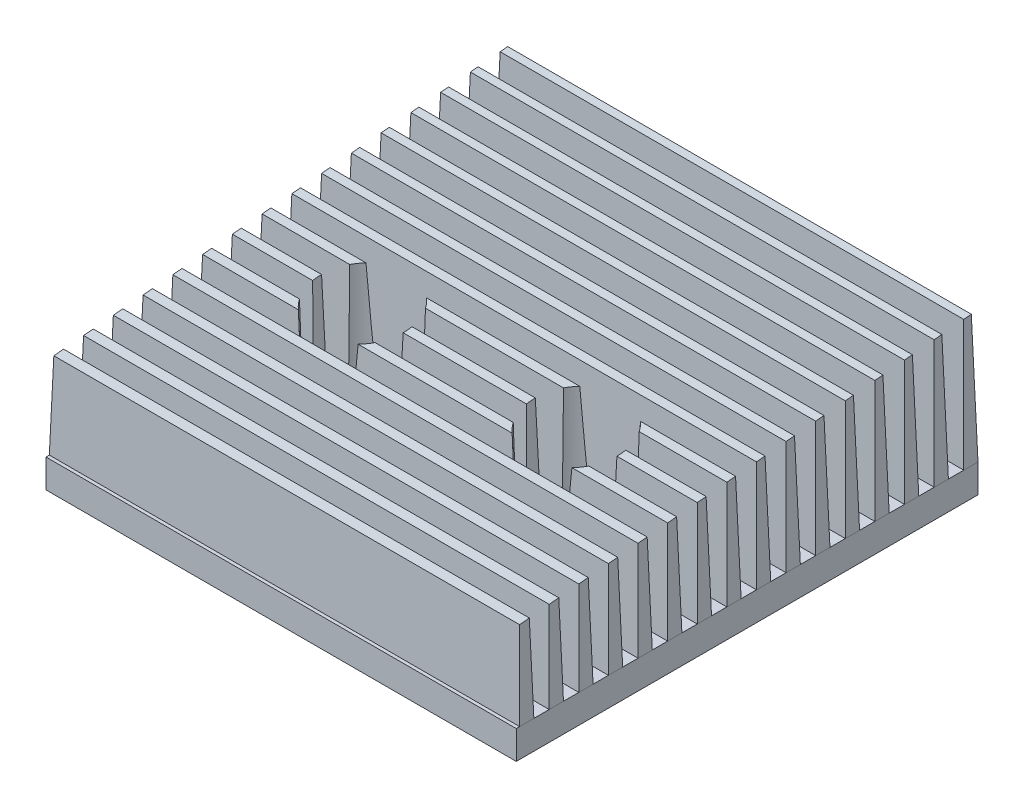
from build123d import *

# Parameters (mm, degrees)
SKETCH1_W                  = 41.91
SKETCH1_H                  = 48.768
SKETCH1_R                  = 1.5
BOSS_EXTRUDE1_DEPTH        = 2.54
BOSS_EXTRUDE2_DEPTH        = 11.43
BOSS_EXTRUDE2_DRAFT        = 1.5
BOSS_EXTRUDE2_2_DEPTH      = 11.43
BOSS_EXTRUDE2_2_DRAFT      = 1.5
BOSS_EXTRUDE2_3_DEPTH      = 11.43
BOSS_EXTRUDE2_3_DRAFT      = 1.5
BOSS_EXTRUDE2_4_DEPTH      = 11.43
BOSS_EXTRUDE2_4_DRAFT      = 1.5
BOSS_EXTRUDE2_5_DEPTH      = 11.43
BOSS_EXTRUDE2_5_DRAFT      = 1.5
BOSS_EXTRUDE2_6_DEPTH      = 11.43
BOSS_EXTRUDE2_6_DRAFT      = 1.5
BOSS_EXTRUDE2_7_DEPTH      = 11.43
BOSS_EXTRUDE2_7_DRAFT      = 1.5
BOSS_EXTRUDE2_8_DEPTH      = 11.43
BOSS_EXTRUDE2_8_DRAFT      = 1.5
BOSS_EXTRUDE2_9_DEPTH      = 11.43
BOSS_EXTRUDE2_9_DRAFT      = 1.5
BOSS_EXTRUDE2_10_OUTLINE_W = 41.311389832
BOSS_EXTRUDE2_10_OUTLINE_H = 0.671389833
BOSS_EXTRUDE2_10_DEPTH     = 11.43
BOSS_EXTRUDE2_10_DRAFT     = 1.5
BOSS_EXTRUDE2_11_OUTLINE_W = 41.311389832
BOSS_EXTRUDE2_11_OUTLINE_H = 0.671389833
BOSS_EXTRUDE2_11_DEPTH     = 11.43
BOSS_EXTRUDE2_11_DRAFT     = 1.5
BOSS_EXTRUDE2_12_OUTLINE_W = 41.311389832
BOSS_EXTRUDE2_12_OUTLINE_H = 0.671389833
BOSS_EXTRUDE2_12_DEPTH     = 11.43
BOSS_EXTRUDE2_12_DRAFT     = 1.5
BOSS_EXTRUDE2_13_OUTLINE_W = 41.311389832
BOSS_EXTRUDE2_13_OUTLINE_H = 0.671389833
BOSS_EXTRUDE2_13_DEPTH     = 11.43
BOSS_EXTRUDE2_13_DRAFT     = 1.5
BOSS_EXTRUDE2_14_OUTLINE_W = 41.311389832
BOSS_EXTRUDE2_14_OUTLINE_H = 0.671389833
BOSS_EXTRUDE2_14_DEPTH     = 11.43
BOSS_EXTRUDE2_14_DRAFT     = 1.5
BOSS_EXTRUDE2_15_OUTLINE_W = 41.311389832
BOSS_EXTRUDE2_15_OUTLINE_H = 0.671389833
BOSS_EXTRUDE2_15_DEPTH     = 11.43
BOSS_EXTRUDE2_15_DRAFT     = 1.5
BOSS_EXTRUDE2_16_OUTLINE_W = 41.311389832
BOSS_EXTRUDE2_16_OUTLINE_H = 0.671389833
BOSS_EXTRUDE2_16_DEPTH     = 11.43
BOSS_EXTRUDE2_16_DRAFT     = 1.5
BOSS_EXTRUDE2_17_OUTLINE_W = 41.311389832
BOSS_EXTRUDE2_17_OUTLINE_H = 0.671389833
BOSS_EXTRUDE2_17_DEPTH     = 11.43
BOSS_EXTRUDE2_17_DRAFT     = 1.5
BOSS_EXTRUDE2_18_OUTLINE_W = 41.311389832
BOSS_EXTRUDE2_18_OUTLINE_H = 0.671389833
BOSS_EXTRUDE2_18_DEPTH     = 11.43
BOSS_EXTRUDE2_18_DRAFT     = 1.5
BOSS_EXTRUDE2_19_OUTLINE_W = 41.311389832
BOSS_EXTRUDE2_19_OUTLINE_H = 0.671389833
BOSS_EXTRUDE2_19_DEPTH     = 11.43
BOSS_EXTRUDE2_19_DRAFT     = 1.5
BOSS_EXTRUDE2_20_OUTLINE_W = 41.311389832
BOSS_EXTRUDE2_20_OUTLINE_H = 0.671389833
BOSS_EXTRUDE2_20_DEPTH     = 11.43
BOSS_EXTRUDE2_20_DRAFT     = 1.5
BOSS_EXTRUDE2_21_OUTLINE_W = 41.311389832
BOSS_EXTRUDE2_21_OUTLINE_H = 0.671389833
BOSS_EXTRUDE2_21_DEPTH     = 11.43
BOSS_EXTRUDE2_21_DRAFT     = 1.5
BOSS_EXTRUDE2_22_OUTLINE_W = 41.311389832
BOSS_EXTRUDE2_22_OUTLINE_H = 0.671389833
BOSS_EXTRUDE2_22_DEPTH     = 11.43
BOSS_EXTRUDE2_22_DRAFT     = 1.5
BOSS_EXTRUDE2_23_OUTLINE_W = 41.311389832
BOSS_EXTRUDE2_23_OUTLINE_H = 0.671389833
BOSS_EXTRUDE2_23_DEPTH     = 11.43
BOSS_EXTRUDE2_23_DRAFT     = 1.5
BOSS_EXTRUDE2_24_OUTLINE_W = 41.311389832
BOSS_EXTRUDE2_24_OUTLINE_H = 0.671389832
BOSS_EXTRUDE2_24_DEPTH     = 11.43
BOSS_EXTRUDE2_24_DRAFT     = 1.5
BOSS_EXTRUDE2_25_OUTLINE_W = 41.311389832
BOSS_EXTRUDE2_25_OUTLINE_H = 0.671389832
BOSS_EXTRUDE2_25_DEPTH     = 11.43
BOSS_EXTRUDE2_25_DRAFT     = 1.5
CUT_EXTRUDE1_DEPTH         = 35.122373613
CUT_EXTRUDE1_DEPTH_BACK    = 35.122373613
SKETCH3_W                  = 41.91
SKETCH3_H                  = 7.62
CUT_EXTRUDE2_DEPTH         = 51.459770669
CUT_EXTRUDE2_DEPTH_BACK    = 51.459770669
SKETCH4_OUTSIDE_W          = 55.222
SKETCH4_OUTSIDE_H          = 28.044


# Read off the part's stored shape, not the designer's step: Boss-Extrude2
with BuildPart() as part:
    # Sketch1 → Boss-Extrude1 (new body)
    with BuildSketch(Plane(origin=(0, 0, 0), x_dir=(1, 0, 0), z_dir=(0, 1, 0))):
        Rectangle(SKETCH1_W, SKETCH1_H)
        with Locations(Location((-9.525, 0, 0), (0, 0, 270))):
            Circle(SKETCH1_R, mode=Mode.SUBTRACT)
        with Locations(Location((9.525, 0, 0), (0, 0, 270))):
            Circle(SKETCH1_R, mode=Mode.SUBTRACT)
    extrude(amount=BOSS_EXTRUDE1_DEPTH)


with BuildPart() as boss_extrude2_tool:
    # Boss-Extrude2 outline → Boss-Extrude2 (with draft: the straight prism first)
    with BuildSketch(Plane(origin=(0, 13.97, 0), x_dir=(1, 0, 0), z_dir=(0, 1, 0))):
        with BuildLine():
            ThreePointArc((6.68970452, -2.974472694), (6.387709227, -2.65401486), (6.121737212, -2.303082861))
            Line((6.121737212, -2.303082861), (-6.121737212, -2.303082861))
            ThreePointArc((-6.121737212, -2.303082861), (-6.387709227, -2.65401486), (-6.68970452, -2.974472694))
            Line((-6.68970452, -2.974472694), (6.68970452, -2.974472694))
        make_face()
    extrude(amount=-BOSS_EXTRUDE2_DEPTH)
    # Boss-Extrude2: the draft: its side faces are tilted about the plane it starts from
    boss_extrude2_sides = [boss_extrude2_tool.faces().sort_by_distance(p)[0] for p in [
        (6.387709227, 8.255, 2.65401486),
        (0, 8.255, 2.303082861),
        (-6.387709227, 8.255, 2.65401486),
        (0, 8.255, 2.974472694),
    ]]
    draft(boss_extrude2_sides, Plane(origin=(0, 13.97, 0), x_dir=(1, 0, 0), z_dir=(0, 1, 0)), BOSS_EXTRUDE2_DRAFT)


with BuildPart() as part_1:
    add(part.part)

    # Boss-Extrude2: add boss_extrude2_tool
    add(boss_extrude2_tool.part)


with BuildPart() as boss_extrude2_2_tool:
    # Boss-Extrude2 2 outline → Boss-Extrude2 2 (with draft: the straight prism first)
    with BuildSketch(Plane(origin=(0, 13.97, 0), x_dir=(1, 0, 0), z_dir=(0, 1, 0))):
        with BuildLine():
            ThreePointArc((5.429429564, -0.335694916), (5.415694916, 0), (5.429429564, 0.335694916))
            Line((5.429429564, 0.335694916), (-5.429429564, 0.335694916))
            ThreePointArc((-5.429429564, 0.335694916), (-5.415694916, 0), (-5.429429564, -0.335694916))
            Line((-5.429429564, -0.335694916), (5.429429564, -0.335694916))
        make_face()
    extrude(amount=-BOSS_EXTRUDE2_2_DEPTH)
    # Boss-Extrude2 2: the draft: its side faces are tilted about the plane it starts from
    boss_extrude2_2_sides = [boss_extrude2_2_tool.faces().sort_by_distance(p)[0] for p in [
        (0, 8.255, 0.335694916),
        (5.415694916, 8.255, 0),
        (0, 8.255, -0.335694916),
        (-5.415694916, 8.255, 0),
    ]]
    draft(boss_extrude2_2_sides, Plane(origin=(0, 13.97, 0), x_dir=(1, 0, 0), z_dir=(0, 1, 0)), BOSS_EXTRUDE2_2_DRAFT)


with BuildPart() as part_2:
    add(part_1.part)

    # Boss-Extrude2 2: add boss_extrude2_2_tool
    add(boss_extrude2_2_tool.part)


with BuildPart() as boss_extrude2_3_tool:
    # Boss-Extrude2 3 outline → Boss-Extrude2 3 (with draft: the straight prism first)
    with BuildSketch(Plane(origin=(0, 13.97, 0), x_dir=(1, 0, 0), z_dir=(0, 1, 0))):
        with BuildLine():
            ThreePointArc((6.121737212, 2.303082861), (6.387709227, 2.65401486), (6.68970452, 2.974472694))
            Line((6.68970452, 2.974472694), (-6.68970452, 2.974472694))
            ThreePointArc((-6.68970452, 2.974472694), (-6.387709227, 2.65401486), (-6.121737212, 2.303082861))
            Line((-6.121737212, 2.303082861), (6.121737212, 2.303082861))
        make_face()
    extrude(amount=-BOSS_EXTRUDE2_3_DEPTH)
    # Boss-Extrude2 3: the draft: its side faces are tilted about the plane it starts from
    boss_extrude2_3_sides = [boss_extrude2_3_tool.faces().sort_by_distance(p)[0] for p in [
        (-6.387709227, 8.255, -2.65401486),
        (0, 8.255, -2.303082861),
        (6.387709227, 8.255, -2.65401486),
        (0, 8.255, -2.974472694),
    ]]
    draft(boss_extrude2_3_sides, Plane(origin=(0, 13.97, 0), x_dir=(1, 0, 0), z_dir=(0, 1, 0)), BOSS_EXTRUDE2_3_DRAFT)


with BuildPart() as part_3:
    add(part_2.part)

    # Boss-Extrude2 3: add boss_extrude2_3_tool
    add(boss_extrude2_3_tool.part)


with BuildPart() as boss_extrude2_4_tool:
    # Boss-Extrude2 4 outline → Boss-Extrude2 4 (with draft: the straight prism first)
    with BuildSketch(Plane(origin=(0, 13.97, 0), x_dir=(1, 0, 0), z_dir=(0, 1, 0))):
        with BuildLine():
            ThreePointArc((12.928262788, -2.303082861), (12.662290773, -2.65401486), (12.36029548, -2.974472694))
            Line((12.36029548, -2.974472694), (20.655694916, -2.974472694))
            Line((20.655694916, -2.974472694), (20.655694916, -2.303082861))
            Line((20.655694916, -2.303082861), (12.928262788, -2.303082861))
        make_face()
    extrude(amount=-BOSS_EXTRUDE2_4_DEPTH)
    # Boss-Extrude2 4: the draft: its side faces are tilted about the plane it starts from
    boss_extrude2_4_sides = [boss_extrude2_4_tool.faces().sort_by_distance(p)[0] for p in [
        (12.662290773, 8.255, 2.65401486),
        (16.507995198, 8.255, 2.974472694),
        (20.655694916, 8.255, 2.638777778),
        (16.791978852, 8.255, 2.303082861),
    ]]
    draft(boss_extrude2_4_sides, Plane(origin=(0, 13.97, 0), x_dir=(1, 0, 0), z_dir=(0, 1, 0)), BOSS_EXTRUDE2_4_DRAFT)


with BuildPart() as part_4:
    add(part_3.part)

    # Boss-Extrude2 4: add boss_extrude2_4_tool
    add(boss_extrude2_4_tool.part)


with BuildPart() as boss_extrude2_5_tool:
    # Boss-Extrude2 5 outline → Boss-Extrude2 5 (with draft: the straight prism first)
    with BuildSketch(Plane(origin=(0, 13.97, 0), x_dir=(1, 0, 0), z_dir=(0, 1, 0))):
        with BuildLine():
            ThreePointArc((13.620570436, 0.335694916), (13.634305084, 0), (13.620570436, -0.335694916))
            Line((13.620570436, -0.335694916), (20.655694916, -0.335694916))
            Line((20.655694916, -0.335694916), (20.655694916, 0.335694916))
            Line((20.655694916, 0.335694916), (13.620570436, 0.335694916))
        make_face()
    extrude(amount=-BOSS_EXTRUDE2_5_DEPTH)
    # Boss-Extrude2 5: the draft: its side faces are tilted about the plane it starts from
    boss_extrude2_5_sides = [boss_extrude2_5_tool.faces().sort_by_distance(p)[0] for p in [
        (13.634305084, 8.255, 0),
        (17.138132676, 8.255, 0.335694916),
        (20.655694916, 8.255, 0),
        (17.138132676, 8.255, -0.335694916),
    ]]
    draft(boss_extrude2_5_sides, Plane(origin=(0, 13.97, 0), x_dir=(1, 0, 0), z_dir=(0, 1, 0)), BOSS_EXTRUDE2_5_DRAFT)


with BuildPart() as part_5:
    add(part_4.part)

    # Boss-Extrude2 5: add boss_extrude2_5_tool
    add(boss_extrude2_5_tool.part)


with BuildPart() as boss_extrude2_6_tool:
    # Boss-Extrude2 6 outline → Boss-Extrude2 6 (with draft: the straight prism first)
    with BuildSketch(Plane(origin=(0, 13.97, 0), x_dir=(1, 0, 0), z_dir=(0, 1, 0))):
        with BuildLine():
            ThreePointArc((12.36029548, 2.974472694), (12.662290773, 2.65401486), (12.928262788, 2.303082861))
            Line((12.928262788, 2.303082861), (20.655694916, 2.303082861))
            Line((20.655694916, 2.303082861), (20.655694916, 2.974472694))
            Line((20.655694916, 2.974472694), (12.36029548, 2.974472694))
        make_face()
    extrude(amount=-BOSS_EXTRUDE2_6_DEPTH)
    # Boss-Extrude2 6: the draft: its side faces are tilted about the plane it starts from
    boss_extrude2_6_sides = [boss_extrude2_6_tool.faces().sort_by_distance(p)[0] for p in [
        (12.662290773, 8.255, -2.65401486),
        (16.791978852, 8.255, -2.303082861),
        (20.655694916, 8.255, -2.638777778),
        (16.507995198, 8.255, -2.974472694),
    ]]
    draft(boss_extrude2_6_sides, Plane(origin=(0, 13.97, 0), x_dir=(1, 0, 0), z_dir=(0, 1, 0)), BOSS_EXTRUDE2_6_DRAFT)


with BuildPart() as part_6:
    add(part_5.part)

    # Boss-Extrude2 6: add boss_extrude2_6_tool
    add(boss_extrude2_6_tool.part)


with BuildPart() as boss_extrude2_7_tool:
    # Boss-Extrude2 7 outline → Boss-Extrude2 7 (with draft: the straight prism first)
    with BuildSketch(Plane(origin=(0, 13.97, 0), x_dir=(1, 0, 0), z_dir=(0, 1, 0))):
        with BuildLine():
            ThreePointArc((-12.36029548, -2.974472694), (-12.662290773, -2.65401486), (-12.928262788, -2.303082861))
            Line((-12.928262788, -2.303082861), (-20.655694916, -2.303082861))
            Line((-20.655694916, -2.303082861), (-20.655694916, -2.974472694))
            Line((-20.655694916, -2.974472694), (-12.36029548, -2.974472694))
        make_face()
    extrude(amount=-BOSS_EXTRUDE2_7_DEPTH)
    # Boss-Extrude2 7: the draft: its side faces are tilted about the plane it starts from
    boss_extrude2_7_sides = [boss_extrude2_7_tool.faces().sort_by_distance(p)[0] for p in [
        (-12.662290773, 8.255, 2.65401486),
        (-16.791978852, 8.255, 2.303082861),
        (-20.655694916, 8.255, 2.638777778),
        (-16.507995198, 8.255, 2.974472694),
    ]]
    draft(boss_extrude2_7_sides, Plane(origin=(0, 13.97, 0), x_dir=(1, 0, 0), z_dir=(0, 1, 0)), BOSS_EXTRUDE2_7_DRAFT)


with BuildPart() as part_7:
    add(part_6.part)

    # Boss-Extrude2 7: add boss_extrude2_7_tool
    add(boss_extrude2_7_tool.part)


with BuildPart() as boss_extrude2_8_tool:
    # Boss-Extrude2 8 outline → Boss-Extrude2 8 (with draft: the straight prism first)
    with BuildSketch(Plane(origin=(0, 13.97, 0), x_dir=(1, 0, 0), z_dir=(0, 1, 0))):
        with BuildLine():
            ThreePointArc((-13.620570436, -0.335694916), (-13.634305084, 0), (-13.620570436, 0.335694916))
            Line((-13.620570436, 0.335694916), (-20.655694916, 0.335694916))
            Line((-20.655694916, 0.335694916), (-20.655694916, -0.335694916))
            Line((-20.655694916, -0.335694916), (-13.620570436, -0.335694916))
        make_face()
    extrude(amount=-BOSS_EXTRUDE2_8_DEPTH)
    # Boss-Extrude2 8: the draft: its side faces are tilted about the plane it starts from
    boss_extrude2_8_sides = [boss_extrude2_8_tool.faces().sort_by_distance(p)[0] for p in [
        (-13.634305084, 8.255, 0),
        (-17.138132676, 8.255, -0.335694916),
        (-20.655694916, 8.255, 0),
        (-17.138132676, 8.255, 0.335694916),
    ]]
    draft(boss_extrude2_8_sides, Plane(origin=(0, 13.97, 0), x_dir=(1, 0, 0), z_dir=(0, 1, 0)), BOSS_EXTRUDE2_8_DRAFT)


with BuildPart() as part_8:
    add(part_7.part)

    # Boss-Extrude2 8: add boss_extrude2_8_tool
    add(boss_extrude2_8_tool.part)


with BuildPart() as boss_extrude2_9_tool:
    # Boss-Extrude2 9 outline → Boss-Extrude2 9 (with draft: the straight prism first)
    with BuildSketch(Plane(origin=(0, 13.97, 0), x_dir=(1, 0, 0), z_dir=(0, 1, 0))):
        with BuildLine():
            ThreePointArc((-12.928262788, 2.303082861), (-12.662290773, 2.65401486), (-12.36029548, 2.974472694))
            Line((-12.36029548, 2.974472694), (-20.655694916, 2.974472694))
            Line((-20.655694916, 2.974472694), (-20.655694916, 2.303082861))
            Line((-20.655694916, 2.303082861), (-12.928262788, 2.303082861))
        make_face()
    extrude(amount=-BOSS_EXTRUDE2_9_DEPTH)
    # Boss-Extrude2 9: the draft: its side faces are tilted about the plane it starts from
    boss_extrude2_9_sides = [boss_extrude2_9_tool.faces().sort_by_distance(p)[0] for p in [
        (-12.662290773, 8.255, -2.65401486),
        (-16.507995198, 8.255, -2.974472694),
        (-20.655694916, 8.255, -2.638777778),
        (-16.791978852, 8.255, -2.303082861),
    ]]
    draft(boss_extrude2_9_sides, Plane(origin=(0, 13.97, 0), x_dir=(1, 0, 0), z_dir=(0, 1, 0)), BOSS_EXTRUDE2_9_DRAFT)


with BuildPart() as part_9:
    add(part_8.part)

    # Boss-Extrude2 9: add boss_extrude2_9_tool
    add(boss_extrude2_9_tool.part)


with BuildPart() as boss_extrude2_10_tool:
    # Boss-Extrude2 10 outline → Boss-Extrude2 10 (with draft: the straight prism first)
    with BuildSketch(Plane(origin=(0, 13.97, 0), x_dir=(1, 0, 0), z_dir=(0, 1, 0))):
        with Locations((0, -21.110222222)):
            Rectangle(BOSS_EXTRUDE2_10_OUTLINE_W, BOSS_EXTRUDE2_10_OUTLINE_H)
    extrude(amount=-BOSS_EXTRUDE2_10_DEPTH)
    # Boss-Extrude2 10: the draft: its side faces are tilted about the plane it starts from
    boss_extrude2_10_sides = [boss_extrude2_10_tool.faces().sort_by_distance(p)[0] for p in [
        (0, 8.255, 20.774527306),
        (-20.655694916, 8.255, 21.110222222),
        (0, 8.255, 21.445917139),
        (20.655694916, 8.255, 21.110222222),
    ]]
    draft(boss_extrude2_10_sides, Plane(origin=(0, 13.97, 0), x_dir=(1, 0, 0), z_dir=(0, 1, 0)), BOSS_EXTRUDE2_10_DRAFT)


with BuildPart() as part_10:
    add(part_9.part)

    # Boss-Extrude2 10: add boss_extrude2_10_tool
    add(boss_extrude2_10_tool.part)


with BuildPart() as boss_extrude2_11_tool:
    # Boss-Extrude2 11 outline → Boss-Extrude2 11 (with draft: the straight prism first)
    with BuildSketch(Plane(origin=(0, 13.97, 0), x_dir=(1, 0, 0), z_dir=(0, 1, 0))):
        with Locations((0, -18.471444445)):
            Rectangle(BOSS_EXTRUDE2_11_OUTLINE_W, BOSS_EXTRUDE2_11_OUTLINE_H)
    extrude(amount=-BOSS_EXTRUDE2_11_DEPTH)
    # Boss-Extrude2 11: the draft: its side faces are tilted about the plane it starts from
    boss_extrude2_11_sides = [boss_extrude2_11_tool.faces().sort_by_distance(p)[0] for p in [
        (0, 8.255, 18.135749528),
        (-20.655694916, 8.255, 18.471444445),
        (0, 8.255, 18.807139361),
        (20.655694916, 8.255, 18.471444445),
    ]]
    draft(boss_extrude2_11_sides, Plane(origin=(0, 13.97, 0), x_dir=(1, 0, 0), z_dir=(0, 1, 0)), BOSS_EXTRUDE2_11_DRAFT)


with BuildPart() as part_11:
    add(part_10.part)

    # Boss-Extrude2 11: add boss_extrude2_11_tool
    add(boss_extrude2_11_tool.part)


with BuildPart() as boss_extrude2_12_tool:
    # Boss-Extrude2 12 outline → Boss-Extrude2 12 (with draft: the straight prism first)
    with BuildSketch(Plane(origin=(0, 13.97, 0), x_dir=(1, 0, 0), z_dir=(0, 1, 0))):
        with Locations((0, -15.832666666)):
            Rectangle(BOSS_EXTRUDE2_12_OUTLINE_W, BOSS_EXTRUDE2_12_OUTLINE_H)
    extrude(amount=-BOSS_EXTRUDE2_12_DEPTH)
    # Boss-Extrude2 12: the draft: its side faces are tilted about the plane it starts from
    boss_extrude2_12_sides = [boss_extrude2_12_tool.faces().sort_by_distance(p)[0] for p in [
        (0, 8.255, 15.49697175),
        (-20.655694916, 8.255, 15.832666666),
        (0, 8.255, 16.168361583),
        (20.655694916, 8.255, 15.832666666),
    ]]
    draft(boss_extrude2_12_sides, Plane(origin=(0, 13.97, 0), x_dir=(1, 0, 0), z_dir=(0, 1, 0)), BOSS_EXTRUDE2_12_DRAFT)


with BuildPart() as part_12:
    add(part_11.part)

    # Boss-Extrude2 12: add boss_extrude2_12_tool
    add(boss_extrude2_12_tool.part)


with BuildPart() as boss_extrude2_13_tool:
    # Boss-Extrude2 13 outline → Boss-Extrude2 13 (with draft: the straight prism first)
    with BuildSketch(Plane(origin=(0, 13.97, 0), x_dir=(1, 0, 0), z_dir=(0, 1, 0))):
        with Locations((0, -13.193888889)):
            Rectangle(BOSS_EXTRUDE2_13_OUTLINE_W, BOSS_EXTRUDE2_13_OUTLINE_H)
    extrude(amount=-BOSS_EXTRUDE2_13_DEPTH)
    # Boss-Extrude2 13: the draft: its side faces are tilted about the plane it starts from
    boss_extrude2_13_sides = [boss_extrude2_13_tool.faces().sort_by_distance(p)[0] for p in [
        (0, 8.255, 12.858193972),
        (-20.655694916, 8.255, 13.193888889),
        (0, 8.255, 13.529583805),
        (20.655694916, 8.255, 13.193888889),
    ]]
    draft(boss_extrude2_13_sides, Plane(origin=(0, 13.97, 0), x_dir=(1, 0, 0), z_dir=(0, 1, 0)), BOSS_EXTRUDE2_13_DRAFT)


with BuildPart() as part_13:
    add(part_12.part)

    # Boss-Extrude2 13: add boss_extrude2_13_tool
    add(boss_extrude2_13_tool.part)


with BuildPart() as boss_extrude2_14_tool:
    # Boss-Extrude2 14 outline → Boss-Extrude2 14 (with draft: the straight prism first)
    with BuildSketch(Plane(origin=(0, 13.97, 0), x_dir=(1, 0, 0), z_dir=(0, 1, 0))):
        with Locations((0, -10.555111112)):
            Rectangle(BOSS_EXTRUDE2_14_OUTLINE_W, BOSS_EXTRUDE2_14_OUTLINE_H)
    extrude(amount=-BOSS_EXTRUDE2_14_DEPTH)
    # Boss-Extrude2 14: the draft: its side faces are tilted about the plane it starts from
    boss_extrude2_14_sides = [boss_extrude2_14_tool.faces().sort_by_distance(p)[0] for p in [
        (0, 8.255, 10.219416195),
        (-20.655694916, 8.255, 10.555111112),
        (0, 8.255, 10.890806028),
        (20.655694916, 8.255, 10.555111112),
    ]]
    draft(boss_extrude2_14_sides, Plane(origin=(0, 13.97, 0), x_dir=(1, 0, 0), z_dir=(0, 1, 0)), BOSS_EXTRUDE2_14_DRAFT)


with BuildPart() as part_14:
    add(part_13.part)

    # Boss-Extrude2 14: add boss_extrude2_14_tool
    add(boss_extrude2_14_tool.part)


with BuildPart() as boss_extrude2_15_tool:
    # Boss-Extrude2 15 outline → Boss-Extrude2 15 (with draft: the straight prism first)
    with BuildSketch(Plane(origin=(0, 13.97, 0), x_dir=(1, 0, 0), z_dir=(0, 1, 0))):
        with Locations((0, -5.277555556)):
            Rectangle(BOSS_EXTRUDE2_15_OUTLINE_W, BOSS_EXTRUDE2_15_OUTLINE_H)
    extrude(amount=-BOSS_EXTRUDE2_15_DEPTH)
    # Boss-Extrude2 15: the draft: its side faces are tilted about the plane it starts from
    boss_extrude2_15_sides = [boss_extrude2_15_tool.faces().sort_by_distance(p)[0] for p in [
        (0, 8.255, 4.941860639),
        (-20.655694916, 8.255, 5.277555556),
        (0, 8.255, 5.613250472),
        (20.655694916, 8.255, 5.277555555),
    ]]
    draft(boss_extrude2_15_sides, Plane(origin=(0, 13.97, 0), x_dir=(1, 0, 0), z_dir=(0, 1, 0)), BOSS_EXTRUDE2_15_DRAFT)


with BuildPart() as part_15:
    add(part_14.part)

    # Boss-Extrude2 15: add boss_extrude2_15_tool
    add(boss_extrude2_15_tool.part)


with BuildPart() as boss_extrude2_16_tool:
    # Boss-Extrude2 16 outline → Boss-Extrude2 16 (with draft: the straight prism first)
    with BuildSketch(Plane(origin=(0, 13.97, 0), x_dir=(1, 0, 0), z_dir=(0, 1, 0))):
        with Locations((0, 5.277555556)):
            Rectangle(BOSS_EXTRUDE2_16_OUTLINE_W, BOSS_EXTRUDE2_16_OUTLINE_H)
    extrude(amount=-BOSS_EXTRUDE2_16_DEPTH)
    # Boss-Extrude2 16: the draft: its side faces are tilted about the plane it starts from
    boss_extrude2_16_sides = [boss_extrude2_16_tool.faces().sort_by_distance(p)[0] for p in [
        (0, 8.255, -5.613250472),
        (-20.655694916, 8.255, -5.277555555),
        (0, 8.255, -4.941860639),
        (20.655694916, 8.255, -5.277555556),
    ]]
    draft(boss_extrude2_16_sides, Plane(origin=(0, 13.97, 0), x_dir=(1, 0, 0), z_dir=(0, 1, 0)), BOSS_EXTRUDE2_16_DRAFT)


with BuildPart() as part_16:
    add(part_15.part)

    # Boss-Extrude2 16: add boss_extrude2_16_tool
    add(boss_extrude2_16_tool.part)


with BuildPart() as boss_extrude2_17_tool:
    # Boss-Extrude2 17 outline → Boss-Extrude2 17 (with draft: the straight prism first)
    with BuildSketch(Plane(origin=(0, 13.97, 0), x_dir=(1, 0, 0), z_dir=(0, 1, 0))):
        with Locations((0, 7.916333334)):
            Rectangle(BOSS_EXTRUDE2_17_OUTLINE_W, BOSS_EXTRUDE2_17_OUTLINE_H)
    extrude(amount=-BOSS_EXTRUDE2_17_DEPTH)
    # Boss-Extrude2 17: the draft: its side faces are tilted about the plane it starts from
    boss_extrude2_17_sides = [boss_extrude2_17_tool.faces().sort_by_distance(p)[0] for p in [
        (0, 8.255, -8.25202825),
        (-20.655694916, 8.255, -7.916333333),
        (0, 8.255, -7.580638417),
        (20.655694916, 8.255, -7.916333333),
    ]]
    draft(boss_extrude2_17_sides, Plane(origin=(0, 13.97, 0), x_dir=(1, 0, 0), z_dir=(0, 1, 0)), BOSS_EXTRUDE2_17_DRAFT)


with BuildPart() as part_17:
    add(part_16.part)

    # Boss-Extrude2 17: add boss_extrude2_17_tool
    add(boss_extrude2_17_tool.part)


with BuildPart() as boss_extrude2_18_tool:
    # Boss-Extrude2 18 outline → Boss-Extrude2 18 (with draft: the straight prism first)
    with BuildSketch(Plane(origin=(0, 13.97, 0), x_dir=(1, 0, 0), z_dir=(0, 1, 0))):
        with Locations((0, 10.555111112)):
            Rectangle(BOSS_EXTRUDE2_18_OUTLINE_W, BOSS_EXTRUDE2_18_OUTLINE_H)
    extrude(amount=-BOSS_EXTRUDE2_18_DEPTH)
    # Boss-Extrude2 18: the draft: its side faces are tilted about the plane it starts from
    boss_extrude2_18_sides = [boss_extrude2_18_tool.faces().sort_by_distance(p)[0] for p in [
        (0, 8.255, -10.890806028),
        (-20.655694916, 8.255, -10.555111112),
        (0, 8.255, -10.219416195),
        (20.655694916, 8.255, -10.555111112),
    ]]
    draft(boss_extrude2_18_sides, Plane(origin=(0, 13.97, 0), x_dir=(1, 0, 0), z_dir=(0, 1, 0)), BOSS_EXTRUDE2_18_DRAFT)


with BuildPart() as part_18:
    add(part_17.part)

    # Boss-Extrude2 18: add boss_extrude2_18_tool
    add(boss_extrude2_18_tool.part)


with BuildPart() as boss_extrude2_19_tool:
    # Boss-Extrude2 19 outline → Boss-Extrude2 19 (with draft: the straight prism first)
    with BuildSketch(Plane(origin=(0, 13.97, 0), x_dir=(1, 0, 0), z_dir=(0, 1, 0))):
        with Locations((0, 13.193888889)):
            Rectangle(BOSS_EXTRUDE2_19_OUTLINE_W, BOSS_EXTRUDE2_19_OUTLINE_H)
    extrude(amount=-BOSS_EXTRUDE2_19_DEPTH)
    # Boss-Extrude2 19: the draft: its side faces are tilted about the plane it starts from
    boss_extrude2_19_sides = [boss_extrude2_19_tool.faces().sort_by_distance(p)[0] for p in [
        (0, 8.255, -13.529583805),
        (-20.655694916, 8.255, -13.193888889),
        (0, 8.255, -12.858193972),
        (20.655694916, 8.255, -13.193888889),
    ]]
    draft(boss_extrude2_19_sides, Plane(origin=(0, 13.97, 0), x_dir=(1, 0, 0), z_dir=(0, 1, 0)), BOSS_EXTRUDE2_19_DRAFT)


with BuildPart() as part_19:
    add(part_18.part)

    # Boss-Extrude2 19: add boss_extrude2_19_tool
    add(boss_extrude2_19_tool.part)


with BuildPart() as boss_extrude2_20_tool:
    # Boss-Extrude2 20 outline → Boss-Extrude2 20 (with draft: the straight prism first)
    with BuildSketch(Plane(origin=(0, 13.97, 0), x_dir=(1, 0, 0), z_dir=(0, 1, 0))):
        with Locations((0, 15.832666666)):
            Rectangle(BOSS_EXTRUDE2_20_OUTLINE_W, BOSS_EXTRUDE2_20_OUTLINE_H)
    extrude(amount=-BOSS_EXTRUDE2_20_DEPTH)
    # Boss-Extrude2 20: the draft: its side faces are tilted about the plane it starts from
    boss_extrude2_20_sides = [boss_extrude2_20_tool.faces().sort_by_distance(p)[0] for p in [
        (0, 8.255, -16.168361583),
        (-20.655694916, 8.255, -15.832666666),
        (0, 8.255, -15.49697175),
        (20.655694916, 8.255, -15.832666666),
    ]]
    draft(boss_extrude2_20_sides, Plane(origin=(0, 13.97, 0), x_dir=(1, 0, 0), z_dir=(0, 1, 0)), BOSS_EXTRUDE2_20_DRAFT)


with BuildPart() as part_20:
    add(part_19.part)

    # Boss-Extrude2 20: add boss_extrude2_20_tool
    add(boss_extrude2_20_tool.part)


with BuildPart() as boss_extrude2_21_tool:
    # Boss-Extrude2 21 outline → Boss-Extrude2 21 (with draft: the straight prism first)
    with BuildSketch(Plane(origin=(0, 13.97, 0), x_dir=(1, 0, 0), z_dir=(0, 1, 0))):
        with Locations((0, 18.471444445)):
            Rectangle(BOSS_EXTRUDE2_21_OUTLINE_W, BOSS_EXTRUDE2_21_OUTLINE_H)
    extrude(amount=-BOSS_EXTRUDE2_21_DEPTH)
    # Boss-Extrude2 21: the draft: its side faces are tilted about the plane it starts from
    boss_extrude2_21_sides = [boss_extrude2_21_tool.faces().sort_by_distance(p)[0] for p in [
        (0, 8.255, -18.807139361),
        (-20.655694916, 8.255, -18.471444445),
        (0, 8.255, -18.135749528),
        (20.655694916, 8.255, -18.471444445),
    ]]
    draft(boss_extrude2_21_sides, Plane(origin=(0, 13.97, 0), x_dir=(1, 0, 0), z_dir=(0, 1, 0)), BOSS_EXTRUDE2_21_DRAFT)


with BuildPart() as part_21:
    add(part_20.part)

    # Boss-Extrude2 21: add boss_extrude2_21_tool
    add(boss_extrude2_21_tool.part)


with BuildPart() as boss_extrude2_22_tool:
    # Boss-Extrude2 22 outline → Boss-Extrude2 22 (with draft: the straight prism first)
    with BuildSketch(Plane(origin=(0, 13.97, 0), x_dir=(1, 0, 0), z_dir=(0, 1, 0))):
        with Locations((0, 21.110222222)):
            Rectangle(BOSS_EXTRUDE2_22_OUTLINE_W, BOSS_EXTRUDE2_22_OUTLINE_H)
    extrude(amount=-BOSS_EXTRUDE2_22_DEPTH)
    # Boss-Extrude2 22: the draft: its side faces are tilted about the plane it starts from
    boss_extrude2_22_sides = [boss_extrude2_22_tool.faces().sort_by_distance(p)[0] for p in [
        (0, 8.255, -21.445917139),
        (-20.655694916, 8.255, -21.110222222),
        (0, 8.255, -20.774527306),
        (20.655694916, 8.255, -21.110222222),
    ]]
    draft(boss_extrude2_22_sides, Plane(origin=(0, 13.97, 0), x_dir=(1, 0, 0), z_dir=(0, 1, 0)), BOSS_EXTRUDE2_22_DRAFT)


with BuildPart() as part_22:
    add(part_21.part)

    # Boss-Extrude2 22: add boss_extrude2_22_tool
    add(boss_extrude2_22_tool.part)


with BuildPart() as boss_extrude2_23_tool:
    # Boss-Extrude2 23 outline → Boss-Extrude2 23 (with draft: the straight prism first)
    with BuildSketch(Plane(origin=(0, 13.97, 0), x_dir=(1, 0, 0), z_dir=(0, 1, 0))):
        with Locations((0, -7.916333334)):
            Rectangle(BOSS_EXTRUDE2_23_OUTLINE_W, BOSS_EXTRUDE2_23_OUTLINE_H)
    extrude(amount=-BOSS_EXTRUDE2_23_DEPTH)
    # Boss-Extrude2 23: the draft: its side faces are tilted about the plane it starts from
    boss_extrude2_23_sides = [boss_extrude2_23_tool.faces().sort_by_distance(p)[0] for p in [
        (20.655694916, 8.255, 7.916333333),
        (0, 8.255, 7.580638417),
        (-20.655694916, 8.255, 7.916333333),
        (0, 8.255, 8.25202825),
    ]]
    draft(boss_extrude2_23_sides, Plane(origin=(0, 13.97, 0), x_dir=(1, 0, 0), z_dir=(0, 1, 0)), BOSS_EXTRUDE2_23_DRAFT)


with BuildPart() as part_23:
    add(part_22.part)

    # Boss-Extrude2 23: add boss_extrude2_23_tool
    add(boss_extrude2_23_tool.part)


with BuildPart() as boss_extrude2_24_tool:
    # Boss-Extrude2 24 outline → Boss-Extrude2 24 (with draft: the straight prism first)
    with BuildSketch(Plane(origin=(0, 13.97, 0), x_dir=(1, 0, 0), z_dir=(0, 1, 0))):
        with Locations((0, 23.749)):
            Rectangle(BOSS_EXTRUDE2_24_OUTLINE_W, BOSS_EXTRUDE2_24_OUTLINE_H)
    extrude(amount=-BOSS_EXTRUDE2_24_DEPTH)
    # Boss-Extrude2 24: the draft: its side faces are tilted about the plane it starts from
    boss_extrude2_24_sides = [boss_extrude2_24_tool.faces().sort_by_distance(p)[0] for p in [
        (0, 8.255, -23.413305084),
        (20.655694916, 8.255, -23.749),
        (0, 8.255, -24.084694916),
        (-20.655694916, 8.255, -23.749),
    ]]
    draft(boss_extrude2_24_sides, Plane(origin=(0, 13.97, 0), x_dir=(1, 0, 0), z_dir=(0, 1, 0)), BOSS_EXTRUDE2_24_DRAFT)


with BuildPart() as part_24:
    add(part_23.part)

    # Boss-Extrude2 24: add boss_extrude2_24_tool
    add(boss_extrude2_24_tool.part)


with BuildPart() as boss_extrude2_25_tool:
    # Boss-Extrude2 25 outline → Boss-Extrude2 25 (with draft: the straight prism first)
    with BuildSketch(Plane(origin=(0, 13.97, 0), x_dir=(1, 0, 0), z_dir=(0, 1, 0))):
        with Locations((0, -23.749)):
            Rectangle(BOSS_EXTRUDE2_25_OUTLINE_W, BOSS_EXTRUDE2_25_OUTLINE_H)
    extrude(amount=-BOSS_EXTRUDE2_25_DEPTH)
    # Boss-Extrude2 25: the draft: its side faces are tilted about the plane it starts from
    boss_extrude2_25_sides = [boss_extrude2_25_tool.faces().sort_by_distance(p)[0] for p in [
        (0, 8.255, 23.413305084),
        (-20.655694916, 8.255, 23.749),
        (0, 8.255, 24.084694916),
        (20.655694916, 8.255, 23.749),
    ]]
    draft(boss_extrude2_25_sides, Plane(origin=(0, 13.97, 0), x_dir=(1, 0, 0), z_dir=(0, 1, 0)), BOSS_EXTRUDE2_25_DRAFT)


with BuildPart() as part_25:
    add(part_24.part)

    # Boss-Extrude2 25: add boss_extrude2_25_tool
    add(boss_extrude2_25_tool.part)

    # Sketch3 → Cut-Extrude1 (cut, two sides: drawn at the far end of the back side and taken through both)
    with BuildSketch(Plane(origin=(0, 2.54, 0), x_dir=(1, 0, 0), z_dir=(0, 1, 0)).offset(-CUT_EXTRUDE1_DEPTH_BACK)):
        with Locations((0, -20.574)):
            Rectangle(SKETCH3_W, SKETCH3_H)
    extrude(amount=CUT_EXTRUDE1_DEPTH + CUT_EXTRUDE1_DEPTH_BACK, mode=Mode.SUBTRACT)

    # Sketch4 outside → Cut-Extrude2 (cut, two sides: drawn at the far end of the back side and taken through both)
    with BuildSketch(Plane.ZY.offset(20.955).offset(-CUT_EXTRUDE2_DEPTH_BACK)):
        with Locations((-3.81, 6.985)):
            Rectangle(SKETCH4_OUTSIDE_W, SKETCH4_OUTSIDE_H)
        Polygon((-24.384, 0), (16.764, 0), (16.764, 10.16), (-24.384, 13.97), align=None, mode=Mode.SUBTRACT)
    extrude(amount=CUT_EXTRUDE2_DEPTH + CUT_EXTRUDE2_DEPTH_BACK, mode=Mode.SUBTRACT)


solid = part_25.part
